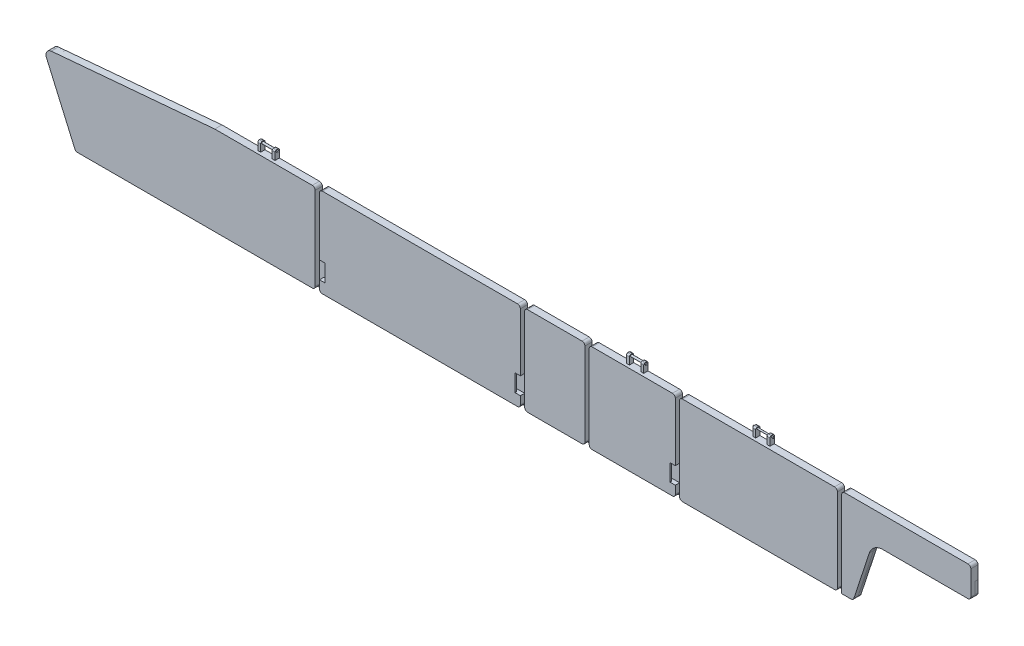
from build123d import *

# Parameters (mm, degrees)
Y_KSEKLIK_EKSTR_ZYON1_DEPTH       = 50
Y_KSEKLIK_EKSTR_ZYON2_DEPTH       = 50
Y_KSEKLIK_EKSTR_ZYON3_DEPTH       = 50
Y_KSEKLIK_EKSTR_ZYON4_DEPTH       = 50
Y_KSEKLIK_EKSTR_ZYON5_DEPTH       = 50
Y_KSEKLIK_EKSTR_ZYON6_DEPTH       = 50
Y_KSEKLIK_EKSTR_ZYON7_DEPTH       = 20
IZIM8_W                           = 37.5
IZIM8_H                           = 120
IZIM8_H_2                         = 117.655236588
Y_KSEKLIK_EKSTR_ZYON8_DEPTH       = 10
IZIM9_W                           = 20
IZIM9_H                           = 60
Y_KSEKLIK_EKSTR_ZYON9_DEPTH       = 30
RADYUS1_R                         = 10
RADYUS2_R                         = 10
RADYUS3_R                         = 10
KES_EKSTR_ZYON1_DEPTH             = 3594
KES_EKSTR_ZYON1_DEPTH_BACK        = 3594
IZIM10_R                          = 5
Y_KSEKLIK_EKSTR_ZYON11_DEPTH      = 5
Y_KSEKLIK_EKSTR_ZYON11_DEPTH_BACK = 127
IZIM14_R                          = 7
Y_KSEKLIK_EKSTR_ZYON12_DEPTH      = 5
Y_KSEKLIK_EKSTR_ZYON12_DEPTH_BACK = 127
IZIM16_R                          = 7


# Read off the part's stored shape, not the designer's step: Yükseklik-Ekstrüzyon7
with BuildPart() as part:
    # Çizim1 → Yükseklik-Ekstrüzyon1 (new body)
    with BuildSketch(Plane.XY):
        with BuildLine():
            Line((3186.053816649, 465.979645309), (2326.053816649, 465.979645309))
            ThreePointArc((2326.053816649, 465.979645309), (2311.911681025, 460.121780932), (2306.053816649, 445.979645309))
            Line((2306.053816649, 445.979645309), (2306.053816649, -154.020354691))
            Line((2306.053816649, -154.020354691), (2371.582899748, -154.020354691))
            ThreePointArc((2371.582899748, -154.020354691), (2383.30680151, -150.223753331), (2390.579605134, -140.27536744))
            Line((2390.579605134, -140.27536744), (2498.424874223, 187.254709053))
            ThreePointArc((2498.424874223, 187.254709053), (2534.788892345, 236.996638509), (2593.408401152, 255.979645309))
            Line((2593.408401152, 255.979645309), (3186.053816649, 255.979645309))
            ThreePointArc((3186.053816649, 255.979645309), (3200.195952273, 261.837509685), (3206.053816649, 275.979645309))
            Line((3206.053816649, 275.979645309), (3206.053816649, 445.979645309))
            ThreePointArc((3206.053816649, 445.979645309), (3200.195952273, 460.121780932), (3186.053816649, 465.979645309))
        make_face()
    extrude(amount=Y_KSEKLIK_EKSTR_ZYON1_DEPTH)


with BuildPart() as body_2:
    # Çizim2 → Yükseklik-Ekstrüzyon2 (new body)
    with BuildSketch(Plane.XY):
        with BuildLine():
            Line((1196.053816649, -154.020354691), (2256.053816649, -154.020354691))
            ThreePointArc((2256.053816649, -154.020354691), (2270.195952273, -148.162490315), (2276.053816649, -134.020354691))
            Line((2276.053816649, -134.020354691), (2276.053816649, 445.979645309))
            ThreePointArc((2276.053816649, 445.979645309), (2270.195952273, 460.121780932), (2256.053816649, 465.979645309))
            Line((2256.053816649, 465.979645309), (1196.053816649, 465.979645309))
            ThreePointArc((1196.053816649, 465.979645309), (1181.911681025, 460.121780932), (1176.053816649, 445.979645309))
            Line((1176.053816649, 445.979645309), (1176.053816649, -134.020354691))
            ThreePointArc((1176.053816649, -134.020354691), (1181.911681025, -148.162490315), (1196.053816649, -154.020354691))
        make_face()
    extrude(amount=Y_KSEKLIK_EKSTR_ZYON2_DEPTH)



with BuildPart() as body_3:
    # Çizim3 → Yükseklik-Ekstrüzyon3 (new body)
    with BuildSketch(Plane.XY):
        with BuildLine():
            ThreePointArc((546.053816649, -134.020354691), (551.911681025, -148.162490315), (566.053816649, -154.020354691))
            Line((566.053816649, -154.020354691), (1126.053816649, -154.020354691))
            ThreePointArc((1126.053816649, -154.020354691), (1140.195952273, -148.162490315), (1146.053816649, -134.020354691))
            Line((1146.053816649, -134.020354691), (1146.053816649, -79.020354691))
            Line((1146.053816649, -79.020354691), (1071.053816649, -79.020354691))
            Line((1071.053816649, -79.020354691), (1071.053816649, 38.634881897))
            Line((1071.053816649, 38.634881897), (1146.053816649, 38.634881897))
            Line((1146.053816649, 38.634881897), (1146.053816649, 445.979645309))
            ThreePointArc((1146.053816649, 445.979645309), (1140.195952273, 460.121780932), (1126.053816649, 465.979645309))
            Line((1126.053816649, 465.979645309), (566.053816649, 465.979645309))
            ThreePointArc((566.053816649, 465.979645309), (551.911681025, 460.121780932), (546.053816649, 445.979645309))
            Line((546.053816649, 445.979645309), (546.053816649, -134.020354691))
        make_face()
    extrude(amount=Y_KSEKLIK_EKSTR_ZYON3_DEPTH)



with BuildPart() as body_4:
    # Çizim4 → Yükseklik-Ekstrüzyon4 (new body)
    with BuildSketch(Plane.XY):
        with BuildLine():
            Line((116.053816649, -154.020354691), (496.053816649, -154.020354691))
            ThreePointArc((496.053816649, -154.020354691), (510.195952273, -148.162490315), (516.053816649, -134.020354691))
            Line((516.053816649, -134.020354691), (516.053816649, 445.979645309))
            ThreePointArc((516.053816649, 445.979645309), (510.195952273, 460.121780932), (496.053816649, 465.979645309))
            Line((496.053816649, 465.979645309), (116.053816649, 465.979645309))
            ThreePointArc((116.053816649, 465.979645309), (101.911681025, 460.121780932), (96.053816649, 445.979645309))
            Line((96.053816649, 445.979645309), (96.053816649, -134.020354691))
            ThreePointArc((96.053816649, -134.020354691), (101.911681025, -148.162490315), (116.053816649, -154.020354691))
        make_face()
    extrude(amount=Y_KSEKLIK_EKSTR_ZYON4_DEPTH)


with BuildPart() as body_5:
    # Çizim5 → Yükseklik-Ekstrüzyon5 (new body)
    with BuildSketch(Plane.XY):
        with BuildLine():
            Line((46.053816649, 465.979645309), (-1313.946183351, 465.979645309))
            ThreePointArc((-1313.946183351, 465.979645309), (-1328.088318975, 460.121780932), (-1333.946183351, 445.979645309))
            Line((-1333.946183351, 445.979645309), (-1333.946183351, 40.979645309))
            Line((-1333.946183351, 40.979645309), (-1258.946183351, 40.979645309))
            Line((-1258.946183351, 40.979645309), (-1258.946183351, -79.020354691))
            Line((-1258.946183351, -79.020354691), (-1333.946183351, -79.020354691))
            Line((-1333.946183351, -79.020354691), (-1333.946183351, -134.020354691))
            ThreePointArc((-1333.946183351, -134.020354691), (-1328.088318975, -148.162490315), (-1313.946183351, -154.020354691))
            Line((-1313.946183351, -154.020354691), (46.053816649, -154.020354691))
            ThreePointArc((46.053816649, -154.020354691), (60.195952273, -148.162490315), (66.053816649, -134.020354691))
            Line((66.053816649, -134.020354691), (66.053816649, -79.020354691))
            Line((66.053816649, -79.020354691), (-8.946183351, -79.020354691))
            Line((-8.946183351, -79.020354691), (-8.946183351, 40.979645309))
            Line((-8.946183351, 40.979645309), (66.053816649, 40.979645309))
            Line((66.053816649, 40.979645309), (66.053816649, 445.979645309))
            ThreePointArc((66.053816649, 445.979645309), (60.195952273, 460.121780932), (46.053816649, 465.979645309))
        make_face()
    extrude(amount=Y_KSEKLIK_EKSTR_ZYON5_DEPTH)


with BuildPart() as body_6:
    # Çizim6 → Yükseklik-Ekstrüzyon6 (new body)
    with BuildSketch(Plane.XY):
        with BuildLine():
            Line((-1383.946183351, 465.979645309), (-2063.946183351, 465.979645309))
            Line((-2063.946183351, 465.979645309), (-3203.901430875, 366.246529353))
            ThreePointArc((-3203.901430875, 366.246529353), (-3234.813536631, 346.813310229), (-3237.063052486, 310.369545793))
            Line((-3237.063052486, 310.369545793), (-3039.188410578, -142.034952441))
            ThreePointArc((-3039.188410578, -142.034952441), (-3031.812271893, -150.757916566), (-3020.864485701, -154.020354691))
            Line((-3020.864485701, -154.020354691), (-1383.946183351, -154.020354691))
            ThreePointArc((-1383.946183351, -154.020354691), (-1369.804047727, -148.162490315), (-1363.946183351, -134.020354691))
            Line((-1363.946183351, -134.020354691), (-1363.946183351, 445.979645309))
            ThreePointArc((-1363.946183351, 445.979645309), (-1369.804047727, 460.121780932), (-1383.946183351, 465.979645309))
        make_face()
    extrude(amount=Y_KSEKLIK_EKSTR_ZYON6_DEPTH)


with BuildPart() as body_7:
    # Yükseklik-Ekstrüzyon7 outline → Yükseklik-Ekstrüzyon7 (new body)
    with BuildSketch(Plane.XY):
        with BuildLine():
            Line((3206.053816649, 275.979645309), (3206.053816649, 355.979645309))
            Line((3206.053816649, 355.979645309), (3176.053816649, 355.979645309))
            Line((3176.053816649, 355.979645309), (3176.053816649, 405.979645309))
            Line((3176.053816649, 405.979645309), (-2208.046077191, 405.979645309))
            Line((-2208.046077191, 405.979645309), (-3148.053022498, 323.739731172))
            Line((-3148.053022498, 323.739731172), (-3153.810292691, 370.628934104))
            Line((-3153.810292691, 370.628934104), (-3203.901430875, 366.246529353))
            ThreePointArc((-3203.901430875, 366.246529353), (-3234.813536631, 346.813310229), (-3237.063052486, 310.369545793))
            Line((-3237.063052486, 310.369545793), (-3039.188410578, -142.034952441))
            ThreePointArc((-3039.188410578, -142.034952441), (-3031.812271893, -150.757916566), (-3020.864485701, -154.020354691))
            Line((-3020.864485701, -154.020354691), (2371.582899748, -154.020354691))
            ThreePointArc((2371.582899748, -154.020354691), (2383.30680151, -150.223753331), (2390.579605134, -140.27536744))
            Line((2390.579605134, -140.27536744), (2498.424874223, 187.254709053))
            ThreePointArc((2498.424874223, 187.254709053), (2534.788892345, 236.996638509), (2593.408401152, 255.979645309))
            Line((2593.408401152, 255.979645309), (3186.053816649, 255.979645309))
            ThreePointArc((3186.053816649, 255.979645309), (3200.195952273, 261.837509685), (3206.053816649, 275.979645309))
        make_face()
    extrude(amount=Y_KSEKLIK_EKSTR_ZYON7_DEPTH)


with BuildPart() as body_3_1:
    add(body_3.part)

    add(body_5.part)  # Yükseklik-Ekstrüzyon8 merges body 5
    # Çizim8 → Yükseklik-Ekstrüzyon8 (add)
    with BuildSketch(Plane.XY.offset(50)):
        with Locations((-1277.696183351, -19.020354691)):
            Rectangle(IZIM8_W, IZIM8_H)
        with Locations((9.803816649, -19.020354691)):
            Rectangle(IZIM8_W, IZIM8_H)
        with Locations((1089.803816649, -20.192736397)):
            Rectangle(IZIM8_W, IZIM8_H_2)
    extrude(amount=-Y_KSEKLIK_EKSTR_ZYON8_DEPTH)


with BuildPart() as body_2_1:
    add(body_2.part)

    add(body_3_1.part)  # Yükseklik-Ekstrüzyon9 merges body 3

    add(body_6.part)  # Yükseklik-Ekstrüzyon9 merges body 6
    # Çizim9 → Yükseklik-Ekstrüzyon9 (add)
    with BuildSketch(Plane.XY):
        with Locations((-1673.946183351, 495.979645309)):
            Rectangle(IZIM9_W, IZIM9_H)
        with Locations((-1773.946183351, 495.979645309)):
            Rectangle(IZIM9_W, IZIM9_H)
        with Locations((896.053816649, 495.979645309)):
            Rectangle(IZIM9_W, IZIM9_H)
        with Locations((796.053816649, 495.979645309)):
            Rectangle(IZIM9_W, IZIM9_H)
        with Locations((1776.053816649, 495.979645309)):
            Rectangle(IZIM9_W, IZIM9_H)
        with Locations((1676.053816649, 495.979645309)):
            Rectangle(IZIM9_W, IZIM9_H)
    extrude(amount=Y_KSEKLIK_EKSTR_ZYON9_DEPTH)

    # Radyus1
    radyus1_edges = [body_2_1.edges().sort_by_distance(p)[0] for p in [
        (796.053816649, 525.979645309, 0),
        (796.053816649, 525.979645309, 30),
        (896.053816649, 525.979645309, 0),
        (896.053816649, 525.979645309, 30),
    ]]
    fillet(radyus1_edges, radius=RADYUS1_R)

    # Radyus2
    radyus2_edges = [body_2_1.edges().sort_by_distance(p)[0] for p in [
        (-1773.946183351, 525.979645309, 0),
        (-1773.946183351, 525.979645309, 30),
        (-1673.946183351, 525.979645309, 0),
        (-1673.946183351, 525.979645309, 30),
    ]]
    fillet(radyus2_edges, radius=RADYUS2_R)

    # Radyus3
    radyus3_edges = [body_2_1.edges().sort_by_distance(p)[0] for p in [
        (1676.053816649, 525.979645309, 0),
        (1676.053816649, 525.979645309, 30),
        (1776.053816649, 525.979645309, 0),
        (1776.053816649, 525.979645309, 30),
    ]]
    fillet(radyus3_edges, radius=RADYUS3_R)

    # Çizim10 → Kes-Ekstrüzyon1 (cut, two sides: drawn at the far end of the back side and taken through both)
    with BuildSketch(Plane.ZY.offset(-1766.053816649).offset(-KES_EKSTR_ZYON1_DEPTH_BACK)):
        with Locations((15, 515.979645309)):
            Circle(IZIM10_R)
    extrude(amount=KES_EKSTR_ZYON1_DEPTH + KES_EKSTR_ZYON1_DEPTH_BACK, mode=Mode.SUBTRACT)

    # Çizim12 → Döndür1 (revolve)
    with BuildSketch(Plane.XY.offset(15), mode=Mode.PRIVATE) as d_nd_r1_sk:
        Polygon((1656.053816649, 515.979645309), (1656.053816649, 520.979645309), (1666.053816649, 520.979645309), (1786.053816649, 520.979645309), (1796.053816649, 520.979645309), (1796.053816649, 515.979645309), align=None)
    revolve(d_nd_r1_sk.sketch.rotate(Axis((1656.053816649, 515.979645309, 15), (1, 0, 0)), 90), axis=Axis((1656.053816649, 515.979645309, 15), (1, 0, 0)))

    # Çizim14 → Yükseklik-Ekstrüzyon11 (add, two sides: drawn at the far end of the back side and taken through both)
    with BuildSketch(Plane.ZY.offset(-786.053816649).offset(-Y_KSEKLIK_EKSTR_ZYON11_DEPTH_BACK)):
        with Locations((15, 515.979645309)):
            Circle(IZIM14_R)
    extrude(amount=Y_KSEKLIK_EKSTR_ZYON11_DEPTH + Y_KSEKLIK_EKSTR_ZYON11_DEPTH_BACK)

    # Çizim16 → Yükseklik-Ekstrüzyon12 (add, two sides: drawn at the far end of the back side and taken through both)
    with BuildSketch(Plane.ZY.offset(1783.946183351).offset(-Y_KSEKLIK_EKSTR_ZYON12_DEPTH_BACK)):
        with Locations((15, 515.979645309)):
            Circle(IZIM16_R)
    extrude(amount=Y_KSEKLIK_EKSTR_ZYON12_DEPTH + Y_KSEKLIK_EKSTR_ZYON12_DEPTH_BACK)


solid = Compound([part.part, body_4.part, body_7.part, body_2_1.part])
